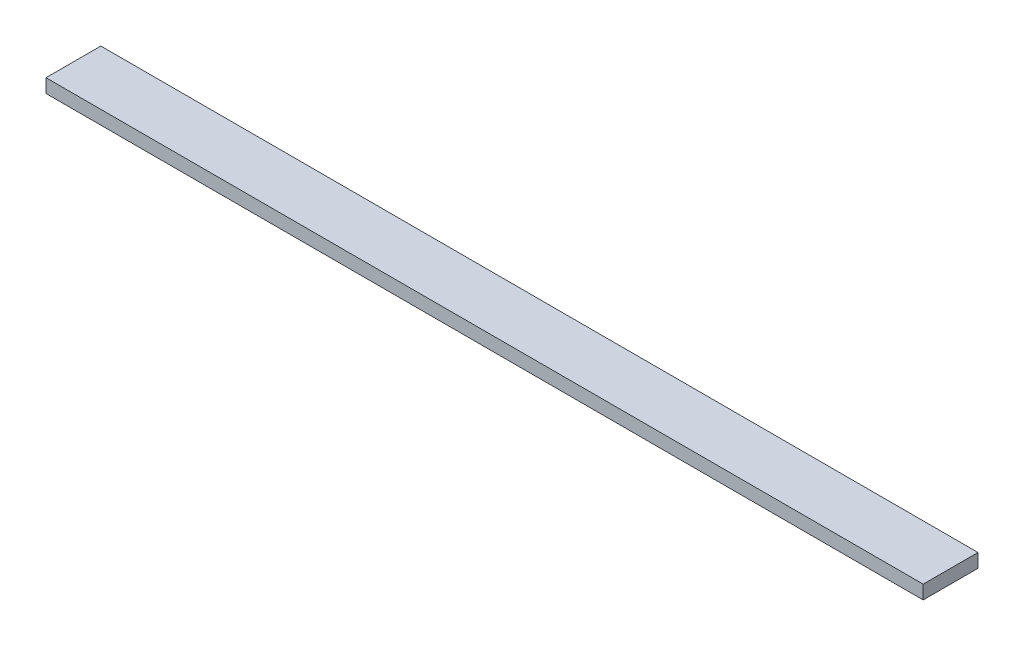
from build123d import *

# Parameters (mm, degrees)
SKETCH1_W           = 406.4
SKETCH1_H           = 25.4
BOSS_EXTRUDE1_DEPTH = 6.35


with BuildPart() as part:
    # Sketch1 → Boss-Extrude1 (new body)
    with BuildSketch(Plane(origin=(0, 0, 0), x_dir=(1, 0, 0), z_dir=(0, 1, 0))):
        with Locations((203.2, 12.7)):
            Rectangle(SKETCH1_W, SKETCH1_H)
    extrude(amount=BOSS_EXTRUDE1_DEPTH)


solid = part.part
